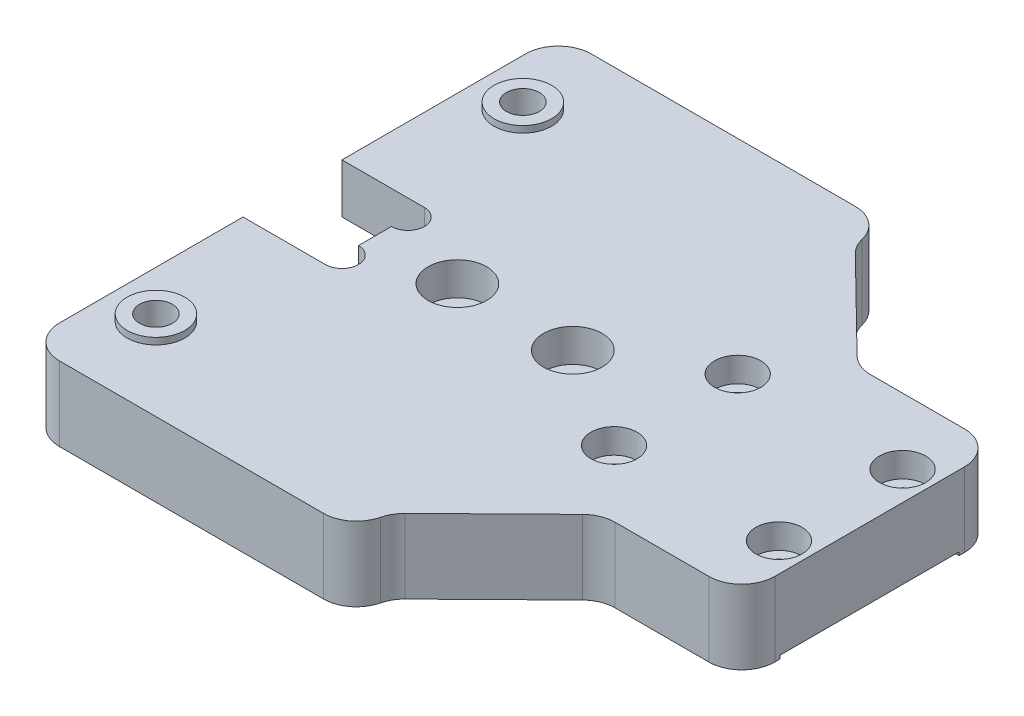
from build123d import *

# Parameters (mm, degrees)
SKETCH1_R               = 12
BOSS_EXTRUDE1_DEPTH     = 4.5
SKETCH2_R               = 1.7
CUT_EXTRUDE1_DEPTH      = 91.980767198
FILLET1_R               = 4
CUT_EXTRUDE4_DEPTH      = 91.980767198
FILLET3_R               = 4
SKETCH6_R               = 1.5
CUT_EXTRUDE5_DEPTH      = 41
CUT_EXTRUDE6_START      = -6
SKETCH7_W               = 30
SKETCH7_H               = 20
CUT_EXTRUDE6_DEPTH      = 3
SKETCH8_W               = 60
SKETCH8_H               = 17
CUT_EXTRUDE8_DEPTH      = 9
FILLET6_R               = 4
SKETCH9_W               = 40
SKETCH9_H               = 22.25
BOSS_EXTRUDE3_DEPTH     = 9
FILLET7_R               = 4
SKETCH13_R              = 3.5
BOSS_EXTRUDE5_DEPTH     = 0.8
CUT_EXTRUDE9_DEPTH      = 2
CUT_EXTRUDE9_DEPTH_BACK = 9
SKETCH10_R              = 2
BOSS_EXTRUDE4_DEPTH     = 9
SKETCH14_R              = 2
CUT_EXTRUDE10_DEPTH     = 16
SKETCH15_W              = 7.5
SKETCH15_H              = 21.7
CUT_EXTRUDE11_DEPTH     = 0.4
CHAMFER2_SIZE           = 0.4
CHAMFER3_SIZE           = 0.6
SKETCH16_W              = 4
SKETCH16_H              = 6
BOSS_EXTRUDE6_DEPTH     = 10
SKETCH17_R              = 2
CUT_EXTRUDE12_DEPTH     = 12.4
SKETCH18_R              = 3.55
CUT_EXTRUDE13_DEPTH     = 4
SKETCH19_R              = 2.8
CUT_EXTRUDE14_DEPTH     = 3
SKETCH20_R              = 2
CUT_EXTRUDE15_DEPTH     = 0.4
FILLET8_R               = 4
SKETCH21_R              = 2
CUT_EXTRUDE16_DEPTH     = 3


# Some blends are built 0.0001 mm under size
with BuildPart() as part:
    # Sketch1 → Boss-Extrude1 (new, symmetric)
    with BuildSketch(Plane(origin=(0, 0, 0), x_dir=(1, 0, 0), z_dir=(0, 1, 0))):
        Polygon((21.5, 20), (21.5, -20), (-20.5, -32.5), (-84.5, -32.5), (-84.5, 32.5), (-20.5, 32.5), align=None)
        with Locations(Location((0, 0, 0), (0, 0, 270))):
            Circle(SKETCH1_R, mode=Mode.SUBTRACT)
    extrude(amount=BOSS_EXTRUDE1_DEPTH, both=True)

    # Sketch2 → Cut-Extrude1 (cut, through all)
    with BuildSketch(Plane(origin=(0, 4.5, 0), x_dir=(1, 0, 0), z_dir=(0, 1, 0))):
        with Locations(Location((15.5, 15.5, 0), (0, 0, 270))):
            Circle(SKETCH2_R)
        with Locations(Location((-15.5, 15.5, 0), (0, 0, 270))):
            Circle(SKETCH2_R)
        with Locations(Location((-15.5, -15.5, 0), (0, 0, 270))):
            Circle(SKETCH2_R)
        with Locations(Location((15.5, -15.5, 0), (0, 0, 270))):
            Circle(SKETCH2_R)
        with Locations(Location((-19.5, 27.5, 0), (0, 0, 270))):
            Circle(SKETCH2_R)
        with Locations(Location((-19.5, -27.5, 0), (0, 0, 270))):
            Circle(SKETCH2_R)
    extrude(amount=-CUT_EXTRUDE1_DEPTH, mode=Mode.SUBTRACT)

    # Fillet1
    fillet1_edges = [part.edges().sort_by_distance(p)[0] for p in [
        (-20.5, 0, 32.5),
        (-84.5, 0, 32.5),
        (-84.5, 0, -32.5),
        (-20.5, 0, -32.5),
        (21.5, 0, -20),
        (21.5, 0, 20),
    ]]
    fillet(fillet1_edges, radius=FILLET1_R)

    # Sketch5 → Cut-Extrude4 (cut, through all)
    with BuildSketch(Plane(origin=(0, 4.5, 0), x_dir=(1, 0, 0), z_dir=(0, 1, 0))):
        Polygon((-24.5, 32.5), (-24.5, 10), (-24.5, -10), (-24.5, -32.5), (26.912022907, -32.5), (26.912022907, 32.5), align=None)
    extrude(amount=-CUT_EXTRUDE4_DEPTH, mode=Mode.SUBTRACT)

    # Fillet3
    fillet3_edges = [part.edges().sort_by_distance(p)[0] for p in [
        (-24.5, 0, -32.5),
        (-24.5, 0, 32.5),
    ]]
    fillet(fillet3_edges, radius=FILLET3_R)

    # Sketch6 → Cut-Extrude5 (cut)
    with BuildSketch(Plane.XZ.offset(4.5)):
        with Locations(Location((-47.999989197, -7.5, 0), (0, 0, 270))):
            Circle(SKETCH6_R)
        with Locations(Location((-47.999989197, 7.5, 0), (0, 0, 270))):
            Circle(SKETCH6_R)
        with Locations(Location((-27.999989197, 7.5, 0), (0, 0, 270))):
            Circle(SKETCH6_R)
        with Locations(Location((-27.999989197, -7.5, 0), (0, 0, 270))):
            Circle(SKETCH6_R)
    extrude(amount=-CUT_EXTRUDE5_DEPTH, mode=Mode.SUBTRACT)

    # Sketch7 → Cut-Extrude6 (cut)
    with BuildSketch(Plane(origin=(0, 4.5, 0), x_dir=(1, 0, 0), z_dir=(0, 1, 0)).offset(CUT_EXTRUDE6_START)):
        with Locations((-69.5, 0)):
            Rectangle(SKETCH7_W, SKETCH7_H)
    extrude(amount=-CUT_EXTRUDE6_DEPTH, mode=Mode.SUBTRACT)

    # Sketch8 → Cut-Extrude8 (cut)
    with BuildSketch(Plane(origin=(0, 4.5, 0), x_dir=(1, 0, 0), z_dir=(0, 1, 0))):
        with Locations((-54.5, 24)):
            Rectangle(SKETCH8_W, SKETCH8_H)
        with Locations((-54.5, -24)):
            Rectangle(SKETCH8_W, SKETCH8_H)
    extrude(amount=-CUT_EXTRUDE8_DEPTH, mode=Mode.SUBTRACT)

    # Fillet6
    fillet6_edges = [part.edges().sort_by_distance(p)[0] for p in [
        (-24.5, 0, -15.5),
        (-24.5, 0, 15.5),
    ]]
    fillet(fillet6_edges, radius=FILLET6_R)

    # Sketch9 → Boss-Extrude3 (add)
    with BuildSketch(Plane(origin=(0, 4.5, 0), x_dir=(1, 0, 0), z_dir=(0, 1, 0))):
        with Locations((-74.5, 21.125)):
            Rectangle(SKETCH9_W, SKETCH9_H)
        with Locations((-74.5, -21.125)):
            Rectangle(SKETCH9_W, SKETCH9_H)
    extrude(amount=-BOSS_EXTRUDE3_DEPTH)

    # Fillet7
    fillet7_edges = [part.edges().sort_by_distance(p)[0] for p in [
        (-54.5, 0, -32.25),
        (-94.5, 0, -32.25),
        (-54.5, 0, 32.25),
        (-94.5, 0, 32.25),
    ]]
    fillet(fillet7_edges, radius=FILLET7_R)

    # Sketch13 → Boss-Extrude5 (add)
    with BuildSketch(Plane(origin=(0, 4.5, 0), x_dir=(1, 0, 0), z_dir=(0, 1, 0))):
        with Locations(Location((-88.81, 22.25, 0), (0, 0, 90))):
            Circle(SKETCH13_R)
        with Locations(Location((-88.81, -22.25, 0), (0, 0, 90))):
            Circle(SKETCH13_R)
    extrude(amount=BOSS_EXTRUDE5_DEPTH)

    # Sketch10 → Cut-Extrude9 (cut, two sides: drawn at the far end of the back side and taken through both)
    with BuildSketch(Plane(origin=(0, 4.5, 0), x_dir=(1, 0, 0), z_dir=(0, 1, 0)).offset(-CUT_EXTRUDE9_DEPTH_BACK)):
        with Locations(Location((-88.81, -22.25, 0), (0, 0, 90))):
            Circle(SKETCH10_R)
        with Locations(Location((-88.81, 22.25, 0), (0, 0, 90))):
            Circle(SKETCH10_R)
    extrude(amount=CUT_EXTRUDE9_DEPTH + CUT_EXTRUDE9_DEPTH_BACK, mode=Mode.SUBTRACT)

    # Sketch11 → Boss-Extrude4 (add)
    with BuildSketch(Plane(origin=(0, 4.5, 0), x_dir=(1, 0, 0), z_dir=(0, 1, 0))):
        Polygon((-54.5, 28.25), (-41.5, 15.5), (-54.5, 15.5), align=None)
        Polygon((-54.5, -28.25), (-41.5, -15.5), (-54.5, -15.5), align=None)
    extrude(amount=-BOSS_EXTRUDE4_DEPTH)

    # Sketch14 → Cut-Extrude10 (cut)
    with BuildSketch(Plane.XZ.offset(1.5)):
        with Locations(Location((-74.5, 0, 0), (0, 0, 270))):
            Circle(SKETCH14_R)
        with Locations(Location((-60.5, 0, 0), (0, 0, 270))):
            Circle(SKETCH14_R)
    extrude(amount=-CUT_EXTRUDE10_DEPTH, mode=Mode.SUBTRACT)

    # Sketch15 → Cut-Extrude11 (cut)
    with BuildSketch(Plane.XZ.offset(4.5)):
        with Locations((-28.25, 0)):
            Rectangle(SKETCH15_W, SKETCH15_H)
        with Locations((-47.75, 0)):
            Rectangle(SKETCH15_W, SKETCH15_H)
    extrude(amount=-CUT_EXTRUDE11_DEPTH, mode=Mode.SUBTRACT)

    # Chamfer2
    chamfer2_edges = [part.edges().sort_by_distance(p)[0] for p in [
        (-32, -4.1, 0),
        (-44, -4.1, 0),
    ]]
    chamfer(chamfer2_edges, length=CHAMFER2_SIZE - 0.0001)  # a hair under: the kernel refuses the full size

    # Chamfer3
    # the kernel refuses this chamfer: 0.6 mm, written as the material it adds along each edge
    with BuildSketch(Plane(origin=(-51.5, -4.1, -12.393009793), x_dir=(-0.027495876610584506, -0.9996219169112968, 0), z_dir=(0, 0, 1))) as chamfer3_piece_1_section:
        Polygon((CHAMFER3_SIZE * 0.999621916911, CHAMFER3_SIZE * 0.0274958766106), (-CHAMFER3_SIZE * 0.0274958766106, CHAMFER3_SIZE * 0.999621916911), (0, 0), align=None)
    chamfer3_piece_1 = extrude(amount=24.786019586, mode=Mode.PRIVATE)
    chamfer3_piece_1 = split(chamfer3_piece_1, bisect_by=Plane(origin=(-51.281581799, -4.5, -11.621504896), z_dir=(0, 1, 0)), keep=Keep.TOP, mode=Mode.PRIVATE)
    add(chamfer3_piece_1)

    # Sketch16 → Boss-Extrude6 (add)
    with BuildSketch(Plane.ZY.offset(84.5)):
        with Locations((-8, 1.5)):
            Rectangle(SKETCH16_W, SKETCH16_H)
        with Locations((8, 1.5)):
            Rectangle(SKETCH16_W, SKETCH16_H)
    extrude(amount=BOSS_EXTRUDE6_DEPTH)

    # Sketch17 → Cut-Extrude12 (cut)
    with BuildSketch(Plane(origin=(0, 4.5, 0), x_dir=(1, 0, 0), z_dir=(0, 1, 0))):
        with Locations((-84.5, 4)):
            Circle(SKETCH17_R)
        with Locations((-84.5, -4)):
            Circle(SKETCH17_R)
    extrude(amount=-CUT_EXTRUDE12_DEPTH, mode=Mode.SUBTRACT)

    # Sketch18 → Cut-Extrude13 (cut)
    with BuildSketch(Plane(origin=(0, 4.5, 0), x_dir=(1, 0, 0), z_dir=(0, 1, 0))):
        with Locations(Location((-74.5, 0, 0), (0, 0, 270))):
            Circle(SKETCH18_R)
        with Locations(Location((-60.5, 0, 0), (0, 0, 270))):
            Circle(SKETCH18_R)
    extrude(amount=-CUT_EXTRUDE13_DEPTH, mode=Mode.SUBTRACT)

    # Sketch19 → Cut-Extrude14 (cut)
    with BuildSketch(Plane(origin=(0, 4.5, 0), x_dir=(1, 0, 0), z_dir=(0, 1, 0))):
        with Locations(Location((-47.999989197, 7.5, 0), (0, 0, 270))):
            Circle(SKETCH19_R)
        with Locations(Location((-27.999989197, 7.5, 0), (0, 0, 270))):
            Circle(SKETCH19_R)
        with Locations(Location((-47.999989197, -7.5, 0), (0, 0, 270))):
            Circle(SKETCH19_R)
        with Locations(Location((-27.999989197, -7.5, 0), (0, 0, 270))):
            Circle(SKETCH19_R)
    extrude(amount=-CUT_EXTRUDE14_DEPTH, mode=Mode.SUBTRACT)

    # Sketch20 → Cut-Extrude15 (cut)
    with BuildSketch(Plane.XZ.offset(4.5)):
        with Locations((-32, 8.85)):
            Circle(SKETCH20_R)
        with Locations((-32, -8.85)):
            Circle(SKETCH20_R)
        with BuildLine():
            Line((-51.3, -6.85), (-50.9, -6.85))
            Line((-50.9, -6.85), (-50.9, -10.85))
            Line((-50.9, -10.85), (-51.3, -10.85))
            ThreePointArc((-51.3, -10.85), (-53.3, -8.85), (-51.3, -6.85))
        make_face()
        with BuildLine():
            Line((-44, -6.85), (-44.4, -6.85))
            Line((-44.4, -6.85), (-44.4, -10.85))
            Line((-44.4, -10.85), (-44, -10.85))
            ThreePointArc((-44, -10.85), (-42, -8.85), (-44, -6.85))
        make_face()
        with BuildLine():
            Line((-51.3, 6.85), (-50.9, 6.85))
            Line((-50.9, 6.85), (-50.9, 10.85))
            Line((-50.9, 10.85), (-51.3, 10.85))
            ThreePointArc((-51.3, 10.85), (-53.3, 8.85), (-51.3, 6.85))
        make_face()
        with BuildLine():
            Line((-44, 6.85), (-44.4, 6.85))
            Line((-44.4, 6.85), (-44.4, 10.85))
            Line((-44.4, 10.85), (-44, 10.85))
            ThreePointArc((-44, 10.85), (-42, 8.85), (-44, 6.85))
        make_face()
    extrude(amount=-CUT_EXTRUDE15_DEPTH, mode=Mode.SUBTRACT)

    # Fillet8
    fillet8_edges = [part.edges().sort_by_distance(p)[0] for p in [
        (-54.5, 0, -28.25),
        (-54.5, 0, 28.25),
        (-41.5, 0, -15.5),
        (-41.5, 0, 15.5),
    ]]
    fillet(fillet8_edges, radius=FILLET8_R)

    # Sketch21 → Cut-Extrude16 (cut)
    with BuildSketch(Plane.XZ.offset(4.5)):
        with Locations((-56.5, 10)):
            Circle(SKETCH21_R)
        with Locations((-56.5, -10)):
            Circle(SKETCH21_R)
    extrude(amount=-CUT_EXTRUDE16_DEPTH, mode=Mode.SUBTRACT)


solid = part.part
